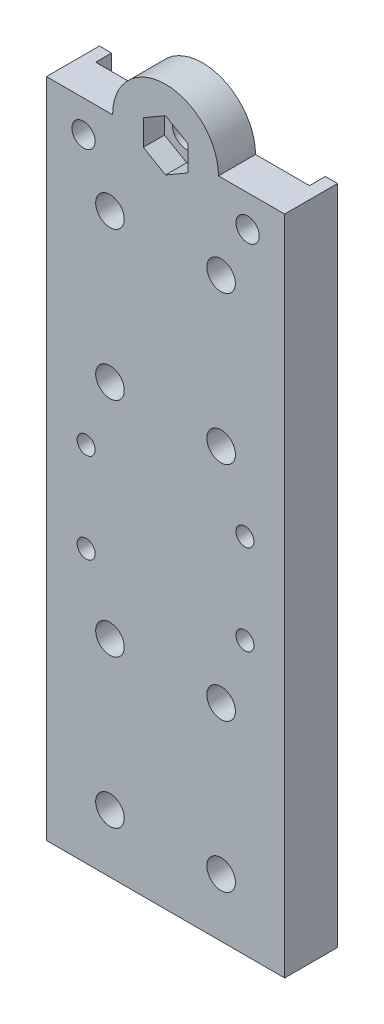
from build123d import *

# Parameters (mm, degrees)
SKETCH_1_W               = 45
SKETCH_1_H               = 110
EXTRUDE_1_DEPTH          = 10
SKETCH_2_W               = 41
SKETCH_2_H               = 110
CUT_EXTRUDE_1_DEPTH      = 3
EXTRUDE_2_DEPTH          = 15
SKETCH_9_R               = 2.5
CUT_EXTRUDE_6_DEPTH      = 75.204110398
CHAMFER_3_SIZE           = 2
EXTRUDE_3_DEPTH          = 10
CUT_EXTRUDE_9_DEPTH      = 84.398141466
CUT_EXTRUDE_10_DEPTH     = 4
SKETCH_14_R              = 2.5
CUT_EXTRUDE_11_DEPTH     = 84.703345214
SKETCH_18_R              = 1.5
CUT_EXTRUDE_12_DEPTH     = 84.703345214
SKETCH_19_R              = 3
CUT_EXTRUDE_13_DEPTH     = 3
SKETCH_20_R              = 4
CUT_EXTRUDE_14_DEPTH     = 3
CHAMFER_4_SIZE           = 1
SKETCH_22_R              = 2
CUT_EXTRUDE_15_DEPTH     = 84.703345214
SKETCH_23_R              = 4
CUT_EXTRUDE_16_DEPTH     = 3
CHAMFER_6_SIZE           = 0.5
SKETCH_24_R              = 2.7
CUT_EXTRUDE_17_DEPTH     = 84.703345214
CUT_EXTRUDE_18_DEPTH     = 4
SKETCH_26_R              = 1.7
CUT_EXTRUDE_19_DEPTH     = 84.703345214
SKETCH_27_R              = 2.2
CUT_EXTRUDE_20_DEPTH     = 84.703345214
SKETCH_28_R              = 4.7
CUT_EXTRUDE_21_DEPTH     = 3
FILLET_1_R               = 1
FILLET_2_R               = 1
SKETCH_29_R              = 5.7
EXTRUDE_4_DEPTH          = 3
SKETCH_30_R              = 2.7
EXTRUDE_5_DEPTH          = 3
CUT_EXTRUDE_START        = -7
CUT_EXTRUDE_22_OUTLINE_R = 2.7
CUT_EXTRUDE_22_DEPTH     = 7
SKETCH_32_R              = 2.7
EXTRUDE_6_DEPTH          = 3
CUT_EXTRUDE_23_OUTLINE_R = 2.7
CUT_EXTRUDE_23_DEPTH     = 7
EXTRUDE_7_REACH          = 85.703
SKETCH_35_R              = 6.776750131
SKETCH_35_R_2            = 7.007153008
SKETCH_35_R_3            = 7.350593446
SKETCH_35_R_4            = 7.056321553
SKETCH_36_R              = 2.7
CUT_EXTRUDE_25_DEPTH     = 84.703345214
EXTRUDE_START            = -7
SKETCH_37_R              = 6.917047826
SKETCH_37_R_2            = 2.7
SKETCH_37_R_3            = 7.137636353
SKETCH_37_R_4            = 7.213157971
SKETCH_37_R_5            = 7.230640972
EXTRUDE_8_DEPTH          = 7
SKETCH_38_R              = 5.066348775
SKETCH_38_R_2            = 5.169326328
SKETCH_38_R_3            = 5.147369905
SKETCH_38_R_4            = 5.241001726
EXTRUDE_9_DEPTH          = 7
SKETCH_39_R              = 1.7
CUT_EXTRUDE_26_DEPTH     = 84.703345214
SKETCH_40_R              = 4.793714361
SKETCH_40_R_2            = 4
SKETCH_40_R_3            = 4.918414757
EXTRUDE_10_DEPTH         = 3
SKETCH_41_R              = 3.5
CUT_EXTRUDE_28_DEPTH     = 3
FILLET_3_R               = 1
SKETCH_42_R              = 5
CUT_EXTRUDE_29_DEPTH     = 3
FILLET_4_R               = 1
SKETCH_43_W              = 2.3
SKETCH_43_H              = 125
EXTRUDE_11_DEPTH         = 3


# Read off the part's stored shape, not the designer's step: Вырез-Вытянуть22, Вырез-Вытянуть23
with BuildPart() as part:
    # Эскиз1 → Бобышка-Вытянуть1 (new body)
    with BuildSketch(Plane.XY):
        Rectangle(SKETCH_1_W, SKETCH_1_H)
    extrude(amount=EXTRUDE_1_DEPTH)

    # Эскиз2 → Вырез-Вытянуть1 (cut)
    with BuildSketch(Plane(origin=(0, 0, 0), x_dir=(-1, 0, 0), z_dir=(0, 0, -1))):
        Rectangle(SKETCH_2_W, SKETCH_2_H)
    extrude(amount=-CUT_EXTRUDE_1_DEPTH, mode=Mode.SUBTRACT)

    # Эскиз6 → Бобышка-Вытянуть2 (add)
    with BuildSketch(Plane(origin=(0, 55, 0), x_dir=(1, 0, 0), z_dir=(0, 1, 0))):
        Polygon((-22.5, -10), (-22.5, 0), (-20.5, 0), (-20.5, -3), (20.5, -3), (20.5, 0), (22.5, 0), (22.5, -10), align=None)
    extrude(amount=EXTRUDE_2_DEPTH)

    # Эскиз9 → Вырез-Вытянуть6 (cut, through all)
    with BuildSketch(Plane.XY.offset(10)):
        with Locations((10.5, -45)):
            Circle(SKETCH_9_R)
        with Locations((-10.5, 25)):
            Circle(SKETCH_9_R)
        with Locations((-10.5, -45)):
            Circle(SKETCH_9_R)
        with Locations((10.5, -15)):
            Circle(SKETCH_9_R)
        with Locations((-10.5, -15)):
            Circle(SKETCH_9_R)
        with Locations((10.5, 25)):
            Circle(SKETCH_9_R)
        with Locations((-10.5, 55)):
            Circle(SKETCH_9_R)
        with Locations((10.5, 55)):
            Circle(SKETCH_9_R)
    extrude(amount=-CUT_EXTRUDE_6_DEPTH, mode=Mode.SUBTRACT)

    # Фаска3
    chamfer_3_edges = [part.edges().sort_by_distance(p)[0] for p in [
        (-13, 55, 3),
        (8, 55, 3),
        (8, 25, 3),
        (-13, 25, 3),
        (8, -15, 3),
        (-13, -15, 3),
        (8, -45, 3),
        (-13, -45, 3),
    ]]
    chamfer(chamfer_3_edges, length=CHAMFER_3_SIZE)

    # Эскиз10 → Бобышка-Вытянуть3 (add)
    with BuildSketch(Plane(origin=(0, 70, 0), x_dir=(1, 0, 0), z_dir=(0, 1, 0))):
        Polygon((-20.5, -3), (22.5, -3), (22.5, -10), (-22.5, -10), (-22.5, -3), align=None)
    extrude(amount=EXTRUDE_3_DEPTH)

    # Эскиз11 → Вырез-Вытянуть9 (cut, through all)
    with BuildSketch(Plane(origin=(0, 0, 3), x_dir=(-1, 0, 0), z_dir=(0, 0, -1))):
        with BuildLine():
            Line((0, 80), (-22.5, 80))
            Line((-22.5, 80), (-22.5, 70))
            Line((-22.5, 70), (-20.5, 70))
            Line((-20.5, 70), (-10, 70))
            ThreePointArc((-10, 70), (-7.071067812, 77.071067812), (0, 80))
        make_face()
        with BuildLine():
            Line((22.5, 80), (0, 80))
            ThreePointArc((0, 80), (7.071067812, 77.071067812), (10, 70))
            Line((10, 70), (20.5, 70))
            Line((20.5, 70), (22.5, 70))
            Line((22.5, 70), (22.5, 80))
        make_face()
    extrude(amount=-CUT_EXTRUDE_9_DEPTH, mode=Mode.SUBTRACT)

    # Эскиз13 → Вырез-Вытянуть10 (cut)
    with BuildSketch(Plane.XY.offset(10)):
        Polygon((-4, 72.309401077), (-4, 70), (4, 70), (4, 72.309401077), (0, 74.618802154), align=None)
        Polygon((4, 70), (-4, 70), (-4, 67.690598923), (0, 65.381197846), (4, 67.690598923), align=None)
    extrude(amount=-CUT_EXTRUDE_10_DEPTH, mode=Mode.SUBTRACT)

    # Эскиз14 → Вырез-Вытянуть11 (cut, through all)
    with BuildSketch(Plane.XY.offset(10)):
        with Locations((0, 70)):
            Circle(SKETCH_14_R)
    extrude(amount=-CUT_EXTRUDE_11_DEPTH, mode=Mode.SUBTRACT)

    # Эскиз18 → Вырез-Вытянуть12 (cut, through all)
    with BuildSketch(Plane.XY.offset(10)):
        with BuildLine():
            ThreePointArc((-15, -5), (-16.060660172, -5.439339828), (-16.5, -6.5))
            Line((-16.5, -6.5), (-15, -6.5))
            Line((-15, -6.5), (-15, -5))
        make_face()
        with BuildLine():
            Line((-15, -6.5), (-16.5, -6.5))
            ThreePointArc((-16.5, -6.5), (-15, -8), (-13.5, -6.5))
            ThreePointArc((-13.5, -6.5), (-13.939339828, -5.439339828), (-15, -5))
            Line((-15, -5), (-15, -6.5))
        make_face()
        with Locations((15, -6.5)):
            Circle(SKETCH_18_R)
        with Locations((15, 10.5)):
            Circle(SKETCH_18_R)
        with Locations((-15, 10.5)):
            Circle(SKETCH_18_R)
    extrude(amount=-CUT_EXTRUDE_12_DEPTH, mode=Mode.SUBTRACT)

    # Эскиз19 → Вырез-Вытянуть13 (cut)
    with BuildSketch(Plane(origin=(0, 0, 3), x_dir=(-1, 0, 0), z_dir=(0, 0, -1))):
        with Locations((-15, 10.5)):
            Circle(SKETCH_19_R)
        with Locations((15, 10.5)):
            Circle(SKETCH_19_R)
        with Locations((15, -6.5)):
            Circle(SKETCH_19_R)
        with Locations((-15, -6.5)):
            Circle(SKETCH_19_R)
    extrude(amount=-CUT_EXTRUDE_13_DEPTH, mode=Mode.SUBTRACT)

    # Эскиз20 → Вырез-Вытянуть14 (cut)
    with BuildSketch(Plane(origin=(0, 0, 3), x_dir=(-1, 0, 0), z_dir=(0, 0, -1))):
        with Locations((-10.5, -15)):
            Circle(SKETCH_20_R)
        with Locations((10.5, -15)):
            Circle(SKETCH_20_R)
        with Locations((10.5, -45)):
            Circle(SKETCH_20_R)
        with Locations((-10.5, -45)):
            Circle(SKETCH_20_R)
        with Locations((-10.5, 25)):
            Circle(SKETCH_20_R)
        with Locations((10.5, 25)):
            Circle(SKETCH_20_R)
        with Locations((10.5, 55)):
            Circle(SKETCH_20_R)
        with Locations((-10.5, 55)):
            Circle(SKETCH_20_R)
    extrude(amount=-CUT_EXTRUDE_14_DEPTH, mode=Mode.SUBTRACT)

    # Фаска4
    chamfer_4_edges = [part.edges().sort_by_distance(p)[0] for p in [
        (18, 10.5, 3),
        (-12, 10.5, 3),
        (-12, -6.5, 3),
        (18, -6.5, 3),
    ]]
    chamfer(chamfer_4_edges, length=CHAMFER_4_SIZE)

    # Эскиз22 → Вырез-Вытянуть15 (cut, through all)
    with BuildSketch(Plane.XY.offset(10)):
        with Locations((-15.5, 64)):
            Circle(SKETCH_22_R)
        with Locations((15.5, 64)):
            Circle(SKETCH_22_R)
    extrude(amount=-CUT_EXTRUDE_15_DEPTH, mode=Mode.SUBTRACT)

    # Эскиз23 → Вырез-Вытянуть16 (cut)
    with BuildSketch(Plane(origin=(0, 0, 3), x_dir=(-1, 0, 0), z_dir=(0, 0, -1))):
        with Locations((-15.5, 64)):
            Circle(SKETCH_23_R)
        with Locations((15.5, 64)):
            Circle(SKETCH_23_R)
    extrude(amount=-CUT_EXTRUDE_16_DEPTH, mode=Mode.SUBTRACT)

    # Фаска6
    chamfer_6_edges = [part.edges().sort_by_distance(p)[0] for p in [
        (19.5, 64, 3),
        (-11.5, 64, 3),
    ]]
    chamfer(chamfer_6_edges, length=CHAMFER_6_SIZE)

    # Эскиз24 → Вырез-Вытянуть17 (cut, through all)
    with BuildSketch(Plane.XY.offset(10)):
        with Locations((0, 70)):
            Circle(SKETCH_24_R)
        with Locations((-10.5, 55)):
            Circle(SKETCH_24_R)
        with Locations((10.5, 55)):
            Circle(SKETCH_24_R)
        with Locations((-10.5, 25)):
            Circle(SKETCH_24_R)
        with Locations((10.5, 25)):
            Circle(SKETCH_24_R)
        with Locations((-10.5, -15)):
            Circle(SKETCH_24_R)
        with Locations((10.5, -15)):
            Circle(SKETCH_24_R)
        with Locations((-10.5, -45)):
            Circle(SKETCH_24_R)
        with Locations((10.5, -45)):
            Circle(SKETCH_24_R)
    extrude(amount=-CUT_EXTRUDE_17_DEPTH, mode=Mode.SUBTRACT)

    # Эскиз25 → Вырез-Вытянуть18 (cut)
    with BuildSketch(Plane.XY.offset(10)):
        Polygon((0, 65.150257739), (4.2, 67.575128869), (4.2, 72.424871131), (0, 74.849742261), (-4.2, 72.424871131), (-4.2, 67.575128869), align=None)
    extrude(amount=-CUT_EXTRUDE_18_DEPTH, mode=Mode.SUBTRACT)

    # Эскиз26 → Вырез-Вытянуть19 (cut, through all)
    with BuildSketch(Plane.XY.offset(10)):
        with Locations((-15.5, 64)):
            Circle(SKETCH_26_R)
        with Locations((15.5, 64)):
            Circle(SKETCH_26_R)
        with Locations((-15, 10.5)):
            Circle(SKETCH_26_R)
        with Locations((15, 10.5)):
            Circle(SKETCH_26_R)
        with Locations((15, -6.5)):
            Circle(SKETCH_26_R)
        with Locations((-15, -6.5)):
            Circle(SKETCH_26_R)
    extrude(amount=-CUT_EXTRUDE_19_DEPTH, mode=Mode.SUBTRACT)

    # Эскиз27 → Вырез-Вытянуть20 (cut, through all)
    with BuildSketch(Plane.XY.offset(10)):
        with Locations((-15.5, 64)):
            Circle(SKETCH_27_R)
        with Locations((15.5, 64)):
            Circle(SKETCH_27_R)
    extrude(amount=-CUT_EXTRUDE_20_DEPTH, mode=Mode.SUBTRACT)

    # Эскиз28 → Вырез-Вытянуть21 (cut)
    with BuildSketch(Plane(origin=(0, 0, 3), x_dir=(-1, 0, 0), z_dir=(0, 0, -1))):
        with Locations((-10.5, -45)):
            Circle(SKETCH_28_R)
        with Locations((10.5, -45)):
            Circle(SKETCH_28_R)
        with Locations((-10.5, -15)):
            Circle(SKETCH_28_R)
        with Locations((10.5, -15)):
            Circle(SKETCH_28_R)
        with Locations((-10.5, 25)):
            Circle(SKETCH_28_R)
        with Locations((10.5, 25)):
            Circle(SKETCH_28_R)
        with Locations((-10.5, 55)):
            Circle(SKETCH_28_R)
        with Locations((10.5, 55)):
            Circle(SKETCH_28_R)
    extrude(amount=-CUT_EXTRUDE_21_DEPTH, mode=Mode.SUBTRACT)

    # Скругление1
    # the kernel refuses this fillet: 1 mm, written as the material it takes off along each edge
    with BuildSketch(Plane(origin=(10.5, -45, 3), x_dir=(-1, 0, 0), z_dir=(0, -1, 0))) as fillet_1_piece_1:
        with BuildLine():
            CenterArc((4.7 + FILLET_1_R, -FILLET_1_R), FILLET_1_R, 90, 90)
            Line((4.7, -FILLET_1_R), (4.7, 0))
            Line((4.7, 0), (4.7 + FILLET_1_R, 0))
        make_face()
    revolve(axis=Axis((10.5, -45, 3), (0, 0, -1)), mode=Mode.SUBTRACT)
    with BuildSketch(Plane(origin=(-10.5, -45, 3), x_dir=(-1, 0, 0), z_dir=(0, -1, 0))) as fillet_1_piece_2:
        with BuildLine():
            CenterArc((4.7 + FILLET_1_R, -FILLET_1_R), FILLET_1_R, 90, 90)
            Line((4.7, -FILLET_1_R), (4.7, 0))
            Line((4.7, 0), (4.7 + FILLET_1_R, 0))
        make_face()
    revolve(axis=Axis((-10.5, -45, 3), (0, 0, -1)), mode=Mode.SUBTRACT)
    with BuildSketch(Plane(origin=(10.5, -15, 3), x_dir=(-1, 0, 0), z_dir=(0, -1, 0))) as fillet_1_piece_3:
        with BuildLine():
            CenterArc((4.7 + FILLET_1_R, -FILLET_1_R), FILLET_1_R, 90, 90)
            Line((4.7, -FILLET_1_R), (4.7, 0))
            Line((4.7, 0), (4.7 + FILLET_1_R, 0))
        make_face()
    revolve(axis=Axis((10.5, -15, 3), (0, 0, -1)), mode=Mode.SUBTRACT)
    with BuildSketch(Plane(origin=(-10.5, -15, 3), x_dir=(-1, 0, 0), z_dir=(0, -1, 0))) as fillet_1_piece_4:
        with BuildLine():
            CenterArc((4.7 + FILLET_1_R, -FILLET_1_R), FILLET_1_R, 90, 90)
            Line((4.7, -FILLET_1_R), (4.7, 0))
            Line((4.7, 0), (4.7 + FILLET_1_R, 0))
        make_face()
    revolve(axis=Axis((-10.5, -15, 3), (0, 0, -1)), mode=Mode.SUBTRACT)
    with BuildSketch(Plane(origin=(10.5, 25, 3), x_dir=(-1, 0, 0), z_dir=(0, -1, 0))) as fillet_1_piece_5:
        with BuildLine():
            CenterArc((4.7 + FILLET_1_R, -FILLET_1_R), FILLET_1_R, 90, 90)
            Line((4.7, -FILLET_1_R), (4.7, 0))
            Line((4.7, 0), (4.7 + FILLET_1_R, 0))
        make_face()
    revolve(axis=Axis((10.5, 25, 3), (0, 0, -1)), mode=Mode.SUBTRACT)
    with BuildSketch(Plane(origin=(-10.5, 25, 3), x_dir=(-1, 0, 0), z_dir=(0, -1, 0))) as fillet_1_piece_6:
        with BuildLine():
            CenterArc((4.7 + FILLET_1_R, -FILLET_1_R), FILLET_1_R, 90, 90)
            Line((4.7, -FILLET_1_R), (4.7, 0))
            Line((4.7, 0), (4.7 + FILLET_1_R, 0))
        make_face()
    revolve(axis=Axis((-10.5, 25, 3), (0, 0, -1)), mode=Mode.SUBTRACT)
    with BuildSketch(Plane(origin=(10.5, 55, 3), x_dir=(-1, 0, 0), z_dir=(0, -1, 0))) as fillet_1_piece_7:
        with BuildLine():
            CenterArc((4.7 + FILLET_1_R, -FILLET_1_R), FILLET_1_R, 90, 90)
            Line((4.7, -FILLET_1_R), (4.7, 0))
            Line((4.7, 0), (4.7 + FILLET_1_R, 0))
        make_face()
    revolve(axis=Axis((10.5, 55, 3), (0, 0, -1)), mode=Mode.SUBTRACT)
    with BuildSketch(Plane(origin=(-10.5, 55, 3), x_dir=(-1, 0, 0), z_dir=(0, -1, 0))) as fillet_1_piece_8:
        with BuildLine():
            CenterArc((4.7 + FILLET_1_R, -FILLET_1_R), FILLET_1_R, 90, 90)
            Line((4.7, -FILLET_1_R), (4.7, 0))
            Line((4.7, 0), (4.7 + FILLET_1_R, 0))
        make_face()
    revolve(axis=Axis((-10.5, 55, 3), (0, 0, -1)), mode=Mode.SUBTRACT)

    # Скругление2
    fillet_2_edges = [part.edges().sort_by_distance(p)[0] for p in [
        (-13.2, 55, 6),
        (7.8, 55, 6),
        (-13.2, 25, 6),
        (7.8, 25, 6),
        (-13.2, -15, 6),
        (7.8, -15, 6),
        (-13.2, -45, 6),
        (7.8, -45, 6),
    ]]
    fillet(fillet_2_edges, radius=FILLET_2_R)

    # Эскиз29 → Бобышка-Вытянуть4 (add)
    with BuildSketch(Plane(origin=(0, 0, 3), x_dir=(-1, 0, 0), z_dir=(0, 0, -1))):
        with Locations((-10.5, 55)):
            Circle(SKETCH_29_R)
        with Locations((10.5, 55)):
            Circle(SKETCH_29_R)
        with Locations((-10.5, 25)):
            Circle(SKETCH_29_R)
        with Locations((10.5, 25)):
            Circle(SKETCH_29_R)
        with Locations((-10.5, -15)):
            Circle(SKETCH_29_R)
        with Locations((10.5, -15)):
            Circle(SKETCH_29_R)
        with Locations((-10.5, -45)):
            Circle(SKETCH_29_R)
        with Locations((10.5, -45)):
            Circle(SKETCH_29_R)
    extrude(amount=-EXTRUDE_4_DEPTH)

    # Эскиз30 → Бобышка-Вытянуть5 (add)
    with BuildSketch(Plane.XY.offset(10)):
        with Locations((-10.5, 55)):
            Circle(SKETCH_30_R)
        with Locations((10.5, 25)):
            Circle(SKETCH_30_R)
    extrude(amount=-EXTRUDE_5_DEPTH)

    # Вырез-Вытянуть22 outline → Вырез-Вытянуть22 (cut)
    with BuildSketch(Plane.XY.offset(10).offset(CUT_EXTRUDE_START)):
        with Locations((-10.5, 54)):
            Circle(CUT_EXTRUDE_22_OUTLINE_R)
        with Locations((10.5, 26)):
            Circle(CUT_EXTRUDE_22_OUTLINE_R)
    extrude(amount=CUT_EXTRUDE_22_DEPTH, mode=Mode.SUBTRACT)

    # Эскиз32 → Бобышка-Вытянуть6 (add)
    with BuildSketch(Plane.XY.offset(10)):
        with Locations((10.5, 55)):
            Circle(SKETCH_32_R)
        with Locations((-10.5, 25)):
            Circle(SKETCH_32_R)
    extrude(amount=-EXTRUDE_6_DEPTH)

    # Вырез-Вытянуть23 outline → Вырез-Вытянуть23 (cut)
    with BuildSketch(Plane.XY.offset(10).offset(CUT_EXTRUDE_START)):
        with Locations((-10.5, 26)):
            Circle(CUT_EXTRUDE_23_OUTLINE_R)
        with Locations((10.5, 54)):
            Circle(CUT_EXTRUDE_23_OUTLINE_R)
    extrude(amount=CUT_EXTRUDE_23_DEPTH, mode=Mode.SUBTRACT)

    # Бобышка-Вытянуть7: up to this face of the body (flat: up to its plane)
    extrude_7_end = Plane(part.part.faces().sort_by_distance((0, 7.49796957, 3))[0])
    # Эскиз35 → Бобышка-Вытянуть7 (add, up to the picked face)
    with BuildSketch(Plane.XY.offset(10), mode=Mode.PRIVATE) as extrude_7_sk1:
        with Locations((-10.5, -15)):
            Circle(SKETCH_35_R)
    extrude_7_tool1 = split(extrude(extrude_7_sk1.sketch, amount=-EXTRUDE_7_REACH, mode=Mode.PRIVATE), bisect_by=extrude_7_end, keep=Keep.BOTH, mode=Mode.PRIVATE)
    # Эскиз35 → Бобышка-Вытянуть7 (add, up to the picked face)
    with BuildSketch(Plane.XY.offset(10), mode=Mode.PRIVATE) as extrude_7_sk2:
        with Locations((10.5, -15)):
            Circle(SKETCH_35_R_2)
    extrude_7_tool2 = split(extrude(extrude_7_sk2.sketch, amount=-EXTRUDE_7_REACH, mode=Mode.PRIVATE), bisect_by=extrude_7_end, keep=Keep.BOTH, mode=Mode.PRIVATE)
    # Эскиз35 → Бобышка-Вытянуть7 (add, up to the picked face)
    with BuildSketch(Plane.XY.offset(10), mode=Mode.PRIVATE) as extrude_7_sk3:
        with Locations((10.5, -45)):
            Circle(SKETCH_35_R_3)
    extrude_7_tool3 = split(extrude(extrude_7_sk3.sketch, amount=-EXTRUDE_7_REACH, mode=Mode.PRIVATE), bisect_by=extrude_7_end, keep=Keep.BOTH, mode=Mode.PRIVATE)
    # Эскиз35 → Бобышка-Вытянуть7 (add, up to the picked face)
    with BuildSketch(Plane.XY.offset(10), mode=Mode.PRIVATE) as extrude_7_sk4:
        with Locations((-10.5, -45)):
            Circle(SKETCH_35_R_4)
    extrude_7_tool4 = split(extrude(extrude_7_sk4.sketch, amount=-EXTRUDE_7_REACH, mode=Mode.PRIVATE), bisect_by=extrude_7_end, keep=Keep.BOTH, mode=Mode.PRIVATE)
    add(extrude_7_tool1.solids().sort_by(Axis((-10.5, -15, 10), (0, 0, -1)))[0])
    add(extrude_7_tool2.solids().sort_by(Axis((10.5, -15, 10), (0, 0, -1)))[0])
    add(extrude_7_tool3.solids().sort_by(Axis((10.5, -45, 10), (0, 0, -1)))[0])
    add(extrude_7_tool4.solids().sort_by(Axis((-10.5, -45, 10), (0, 0, -1)))[0])

    # Эскиз36 → Вырез-Вытянуть25 (cut, through all)
    with BuildSketch(Plane.XY.offset(10)):
        with Locations((-10.5, -16)):
            Circle(SKETCH_36_R)
        with Locations((10.5, -16)):
            Circle(SKETCH_36_R)
        with Locations((-10.5, -44)):
            Circle(SKETCH_36_R)
        with Locations((10.5, -44)):
            Circle(SKETCH_36_R)
    extrude(amount=-CUT_EXTRUDE_25_DEPTH, mode=Mode.SUBTRACT)

    # Эскиз37 → Бобышка-Вытянуть8 (add)
    # profile 1 of 4: a face of its own
    with BuildSketch(Plane.XY.offset(10).offset(EXTRUDE_START)):
        with Locations((-10.5, 54)):
            Circle(SKETCH_37_R)
        with Locations((-10.5, 54)):
            Circle(SKETCH_37_R_2, mode=Mode.SUBTRACT)
    # profile 2 of 4: a face of its own
    with BuildSketch(Plane.XY.offset(10).offset(EXTRUDE_START)):
        with Locations((10.5, 54)):
            Circle(SKETCH_37_R_3)
        with Locations((10.5, 54)):
            Circle(SKETCH_37_R_2, mode=Mode.SUBTRACT)
    # profile 3 of 4: a face of its own
    with BuildSketch(Plane.XY.offset(10).offset(EXTRUDE_START)):
        with Locations((-10.5, 26)):
            Circle(SKETCH_37_R_4)
        with Locations((-10.5, 26)):
            Circle(SKETCH_37_R_2, mode=Mode.SUBTRACT)
    # profile 4 of 4: a face of its own
    with BuildSketch(Plane.XY.offset(10).offset(EXTRUDE_START)):
        with Locations((10.5, 26)):
            Circle(SKETCH_37_R_5)
        with Locations((10.5, 26)):
            Circle(SKETCH_37_R_2, mode=Mode.SUBTRACT)
    extrude(amount=EXTRUDE_8_DEPTH)

    # Эскиз38 → Бобышка-Вытянуть9 (add)
    with BuildSketch(Plane(origin=(0, 0, 3), x_dir=(-1, 0, 0), z_dir=(0, 0, -1))):
        with Locations((-15, 10.5)):
            Circle(SKETCH_38_R)
        with Locations((15, 10.5)):
            Circle(SKETCH_38_R_2)
        with Locations((15, -6.5)):
            Circle(SKETCH_38_R_3)
        with Locations((-15, -6.5)):
            Circle(SKETCH_38_R_4)
    extrude(amount=-EXTRUDE_9_DEPTH)

    # Эскиз39 → Вырез-Вытянуть26 (cut, through all)
    with BuildSketch(Plane.XY.offset(10)):
        with Locations((-15, 13.5)):
            Circle(SKETCH_39_R)
        with Locations((-15, -3.5)):
            Circle(SKETCH_39_R)
        with Locations((15, 13.5)):
            Circle(SKETCH_39_R)
        with Locations((15, -3.5)):
            Circle(SKETCH_39_R)
    extrude(amount=-CUT_EXTRUDE_26_DEPTH, mode=Mode.SUBTRACT)

    # Эскиз40 → Бобышка-Вытянуть10 (add)
    # profile 1 of 2: a face of its own
    with BuildSketch(Plane(origin=(0, 0, 3), x_dir=(-1, 0, 0), z_dir=(0, 0, -1))):
        with Locations((-15.5, 64)):
            Circle(SKETCH_40_R)
        with Locations((-15.5, 64)):
            Circle(SKETCH_40_R_2, mode=Mode.SUBTRACT)
    # profile 2 of 2: a face of its own
    with BuildSketch(Plane(origin=(0, 0, 3), x_dir=(-1, 0, 0), z_dir=(0, 0, -1))):
        with Locations((15.5, 64)):
            Circle(SKETCH_40_R_3)
        with Locations((15.5, 64)):
            Circle(SKETCH_40_R_2, mode=Mode.SUBTRACT)
    extrude(amount=-EXTRUDE_10_DEPTH)

    # Эскиз41 → Вырез-Вытянуть28 (cut)
    with BuildSketch(Plane(origin=(0, 0, 3), x_dir=(-1, 0, 0), z_dir=(0, 0, -1))):
        with Locations((-15, 13.5)):
            Circle(SKETCH_41_R)
        with Locations((15, 13.5)):
            Circle(SKETCH_41_R)
        with Locations((15, -3.5)):
            Circle(SKETCH_41_R)
        with Locations((-15, -3.5)):
            Circle(SKETCH_41_R)
    extrude(amount=-CUT_EXTRUDE_28_DEPTH, mode=Mode.SUBTRACT)

    # Скругление3
    fillet_3_edges = [part.edges().sort_by_distance(p)[0] for p in [
        (-11.5, -3.5, 3),
        (18.5, -3.5, 3),
        (18.5, 13.5, 3),
        (-11.5, 13.5, 3),
    ]]
    fillet(fillet_3_edges, radius=FILLET_3_R)

    # Эскиз42 → Вырез-Вытянуть29 (cut)
    with BuildSketch(Plane(origin=(0, 0, 3), x_dir=(-1, 0, 0), z_dir=(0, 0, -1))):
        with Locations((-10.5, 54)):
            Circle(SKETCH_42_R)
        with Locations((10.5, 54)):
            Circle(SKETCH_42_R)
        with Locations((10.5, 26)):
            Circle(SKETCH_42_R)
        with Locations((-10.5, 26)):
            Circle(SKETCH_42_R)
        with Locations((-10.5, -16)):
            Circle(SKETCH_42_R)
        with Locations((10.5, -16)):
            Circle(SKETCH_42_R)
        with Locations((-10.5, -44)):
            Circle(SKETCH_42_R)
        with Locations((10.5, -44)):
            Circle(SKETCH_42_R)
    extrude(amount=-CUT_EXTRUDE_29_DEPTH, mode=Mode.SUBTRACT)

    # Скругление4
    fillet_4_edges = [part.edges().sort_by_distance(p)[0] for p in [
        (15.5, 54, 3),
        (-5.5, 54, 3),
        (-5.5, 26, 3),
        (15.5, 26, 3),
        (15.5, -16, 3),
        (-5.5, -16, 3),
        (15.5, -44, 3),
        (-5.5, -44, 3),
    ]]
    fillet(fillet_4_edges, radius=FILLET_4_R)

    # Эскиз43 → Бобышка-Вытянуть11 (add)
    with BuildSketch(Plane(origin=(0, 0, 0), x_dir=(-1, 0, 0), z_dir=(0, 0, -1))):
        with Locations((-21.35, 7.5)):
            Rectangle(SKETCH_43_W, SKETCH_43_H)
        with Locations((21.35, 7.5)):
            Rectangle(SKETCH_43_W, SKETCH_43_H)
    extrude(amount=-EXTRUDE_11_DEPTH)


solid = part.part
